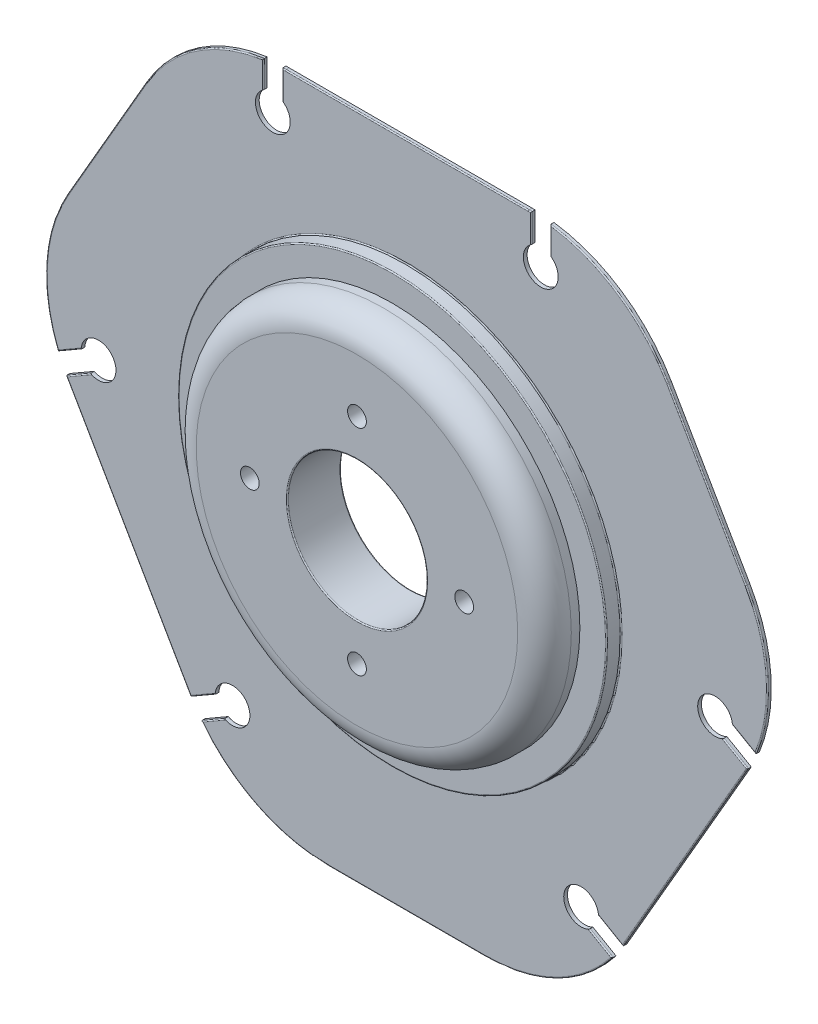
from build123d import *

# Parameters (mm, degrees)
SKETCH5_R           = 35
SKETCH5_R_2         = 1.75
BOSS_EXTRUDE2_DEPTH = 0.7
FILLET1_R           = 30
CIRPATTERN3_DEPTH   = 0.7
SKETCH6_R           = 35
SKETCH6_R_2         = 13
BOSS_EXTRUDE3_DEPTH = 10
SKETCH7_R           = 40
SKETCH7_R_2         = 35
BOSS_EXTRUDE4_DEPTH = 2.7
SKETCH8_W           = 3.5
SKETCH8_H           = 11.20850618
SKETCH8_H_2         = 10.028503604
CUT_EXTRUDE1_DEPTH  = 94.792333251
CIRPATTERN5_COUNT   = 3
FILLET2_R           = 5
FILLET3_R           = 0.2
FILLET4_R           = 0.2
SKETCH10_R          = 3.25
CUT_EXTRUDE3_DEPTH  = 94.792333392
SKETCH11_R          = 1.75
CUT_EXTRUDE4_DEPTH  = 94.864326584


# Read off the part's stored shape, not the designer's step: CirPattern3
with BuildPart() as part:
    # Sketch5 → Boss-Extrude2 (new body)
    with BuildSketch(Plane.XY):
        Polygon((-40, 60), (40, 60), (71.961524227, 4.641016151), (31.961524227, -64.641016151), (-31.961524227, -64.641016151), (-71.961524227, 4.641016151), align=None)
        Circle(SKETCH5_R, mode=Mode.SUBTRACT)
        with Locations((-25, 52)):
            Circle(SKETCH5_R_2, mode=Mode.SUBTRACT)
        with Locations((25, 52)):
            Circle(SKETCH5_R_2, mode=Mode.SUBTRACT)
        with Locations((57.533320997, -4.349364905)):
            Circle(SKETCH5_R_2, mode=Mode.SUBTRACT)
        with Locations((32.533320997, -47.650635095)):
            Circle(SKETCH5_R_2, mode=Mode.SUBTRACT)
        with Locations((-32.533320997, -47.650635095)):
            Circle(SKETCH5_R_2, mode=Mode.SUBTRACT)
        with Locations((-57.533320997, -4.349364905)):
            Circle(SKETCH5_R_2, mode=Mode.SUBTRACT)
    extrude(amount=BOSS_EXTRUDE2_DEPTH)

    # Fillet1
    fillet1_edges = [part.edges().sort_by_distance(p)[0] for p in [
        (-40, 60, 0.35),
        (40, 60, 0.35),
    ]]
    fillet(fillet1_edges, radius=FILLET1_R)

    # CirPattern3 outline → CirPattern3 (cut)
    with BuildSketch(Plane.XY):
        with BuildLine():
            Line((-71.961524227, 4.641016151), (-63.301270189, -10.358983849))
            ThreePointArc((-63.301270189, -10.358983849), (-67.320508076, 4.641016151), (-63.301270189, 19.641016151))
            Line((-63.301270189, 19.641016151), (-71.961524227, 4.641016151))
        make_face()
        with BuildLine():
            Line((-31.961524227, -64.641016151), (-14.641016151, -64.641016151))
            ThreePointArc((-14.641016151, -64.641016151), (-29.641016151, -60.621778265), (-40.621778265, -49.641016151))
            Line((-40.621778265, -49.641016151), (-31.961524227, -64.641016151))
        make_face()
        with BuildLine():
            Line((31.961524227, -64.641016151), (40.621778265, -49.641016151))
            ThreePointArc((40.621778265, -49.641016151), (29.641016151, -60.621778265), (14.641016151, -64.641016151))
            Line((14.641016151, -64.641016151), (31.961524227, -64.641016151))
        make_face()
        with BuildLine():
            ThreePointArc((63.301270189, 19.641016151), (67.320508076, 4.641016151), (63.301270189, -10.358983849))
            Line((63.301270189, -10.358983849), (71.961524227, 4.641016151))
            Line((71.961524227, 4.641016151), (63.301270189, 19.641016151))
        make_face()
    extrude(amount=CIRPATTERN3_DEPTH, mode=Mode.SUBTRACT)

    # Sketch6 → Boss-Extrude3 (add)
    with BuildSketch(Plane.XY):
        Circle(SKETCH6_R)
        Circle(SKETCH6_R_2, mode=Mode.SUBTRACT)
    extrude(amount=BOSS_EXTRUDE3_DEPTH)

    # Sketch7 → Boss-Extrude4 (add)
    with BuildSketch(Plane.XY.offset(0.7)):
        with Locations(Location((0, 0, 0), (0, 0, 180))):
            Circle(SKETCH7_R)
        Circle(SKETCH7_R_2, mode=Mode.SUBTRACT)
    extrude(amount=BOSS_EXTRUDE4_DEPTH)

    # Sketch8 → Cut-Extrude1 (cut, through all)
    with BuildSketch(Plane.XY.offset(0.7)):
        with Locations((-25, 57.60425309)):
            Rectangle(SKETCH8_W, SKETCH8_H)
        with Locations((25, 57.014251802)):
            Rectangle(SKETCH8_W, SKETCH8_H_2)
    cut_extrude1 = extrude(amount=-CUT_EXTRUDE1_DEPTH, mode=Mode.SUBTRACT)

    # CirPattern5: Cut-Extrude1 ×3 about axis
    cirpattern5_axis = Axis((0, 0, 0), (0, 0, 1))
    for i in range(1, CIRPATTERN5_COUNT):
        add(cut_extrude1.rotate(cirpattern5_axis, i * 360 / CIRPATTERN5_COUNT), mode=Mode.SUBTRACT)

    # Fillet2
    fillet2_edges = [part.edges().sort_by_distance(p)[0] for p in [
        (-35, 0, 10),
    ]]
    fillet(fillet2_edges, radius=FILLET2_R)

    # Fillet3
    fillet3_edges = [part.edges().sort_by_distance(p)[0] for p in [
        (-39.411443444, 54.900638513, 0.7),
        (-25, 50.25, 0.7),
        (-26.75, 55.861283289, 0.7),
        (-23.25, 55.997287426, 0.7),
        (22.964758859, 59.998643682, 0.7),
        (26.75, 55.861283289, 0.7),
        (23.25, 55.997287426, 0.7),
        (67.251069358, 6.680991966, 0.7),
        (61.752290417, -4.764462093, 0.7),
        (60.120073454, -7.863553075, 0.7),
        (40.477970192, -49.887386405, 0.7),
        (35.002290416, -51.096821196, 0.7),
        (36.870073454, -48.133734351, 0.7),
        (-27.839625914, -61.581630479, 0.7),
        (-31.01777654, -46.775635095, 0.7),
        (-35.002290416, -51.096821196, 0.7),
        (-36.870073454, -48.133734351, 0.7),
        (-63.442729051, -10.111257277, 0.7),
        (-56.01777654, -3.474364905, 0.7),
        (-61.752290417, -4.764462093, 0.7),
        (-60.120073454, -7.863553075, 0.7),
        (31.01777654, -46.775635095, 0.7),
        (0, 60, 0.7),
        (56.01777654, -3.474364905, 0.7),
        (-55.980762114, 32.320508076, 0.7),
        (-22.964758859, 59.998643682, 0.7),
        (39.411443444, 54.900638513, 0.7),
        (25, 50.25, 0.7),
        (55.980762114, 32.320508076, 0.7),
        (51.961524227, -30, 0.7),
        (63.442729051, -10.111257277, 0.7),
        (0, -64.641016151, 0.7),
        (-51.961524227, -30, 0.7),
        (-40.477970192, -49.887386405, 0.7),
        (27.839625914, -61.581630479, 0.7),
        (-67.251069358, 6.680991966, 0.7),
        (40, 0, 3.4),
        (40, 0, 0.7),
    ]]
    fillet(fillet3_edges, radius=FILLET3_R)

    # Fillet4
    fillet4_edges = [part.edges().sort_by_distance(p)[0] for p in [
        (-13, 0, 0),
        (-13, 0, 10),
    ]]
    fillet(fillet4_edges, radius=FILLET4_R)

    # Sketch10 → Cut-Extrude3 (cut, through all)
    with BuildSketch(Plane.XY.offset(0.7)):
        with Locations((-25, 52)):
            Circle(SKETCH10_R)
        with Locations((25, 52)):
            Circle(SKETCH10_R)
        with Locations((57.533320997, -4.349364905)):
            Circle(SKETCH10_R)
        with Locations((32.533320997, -47.650635095)):
            Circle(SKETCH10_R)
        with Locations((-32.533320997, -47.650635095)):
            Circle(SKETCH10_R)
        with Locations((-57.533320997, -4.349364905)):
            Circle(SKETCH10_R)
    extrude(amount=-CUT_EXTRUDE3_DEPTH, mode=Mode.SUBTRACT)

    # Sketch11 → Cut-Extrude4 (cut, through all)
    with BuildSketch(Plane.XY.offset(10)):
        with Locations((0, 20)):
            Circle(SKETCH11_R)
        with Locations((20, 0)):
            Circle(SKETCH11_R)
        with Locations((0, -20)):
            Circle(SKETCH11_R)
        with Locations((-20, 0)):
            Circle(SKETCH11_R)
    extrude(amount=-CUT_EXTRUDE4_DEPTH, mode=Mode.SUBTRACT)


solid = part.part
